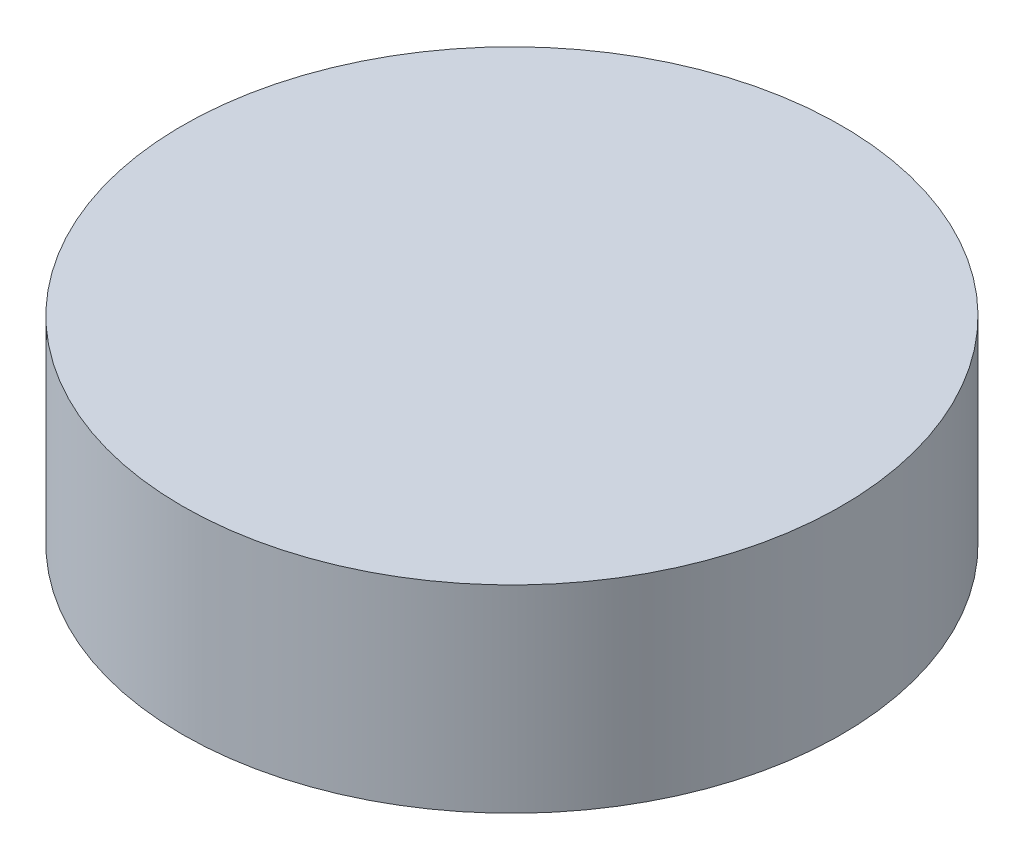
from build123d import *

# Parameters (mm, degrees)
SKETCH1_R           = 25
BOSS_EXTRUDE1_DEPTH = 7.5


with BuildPart() as part:
    # Sketch1 → Boss-Extrude1 (new, symmetric)
    with BuildSketch(Plane(origin=(0, 0, 0), x_dir=(1, 0, 0), z_dir=(0, 1, 0))):
        Circle(SKETCH1_R)
    extrude(amount=BOSS_EXTRUDE1_DEPTH, both=True)


solid = part.part
